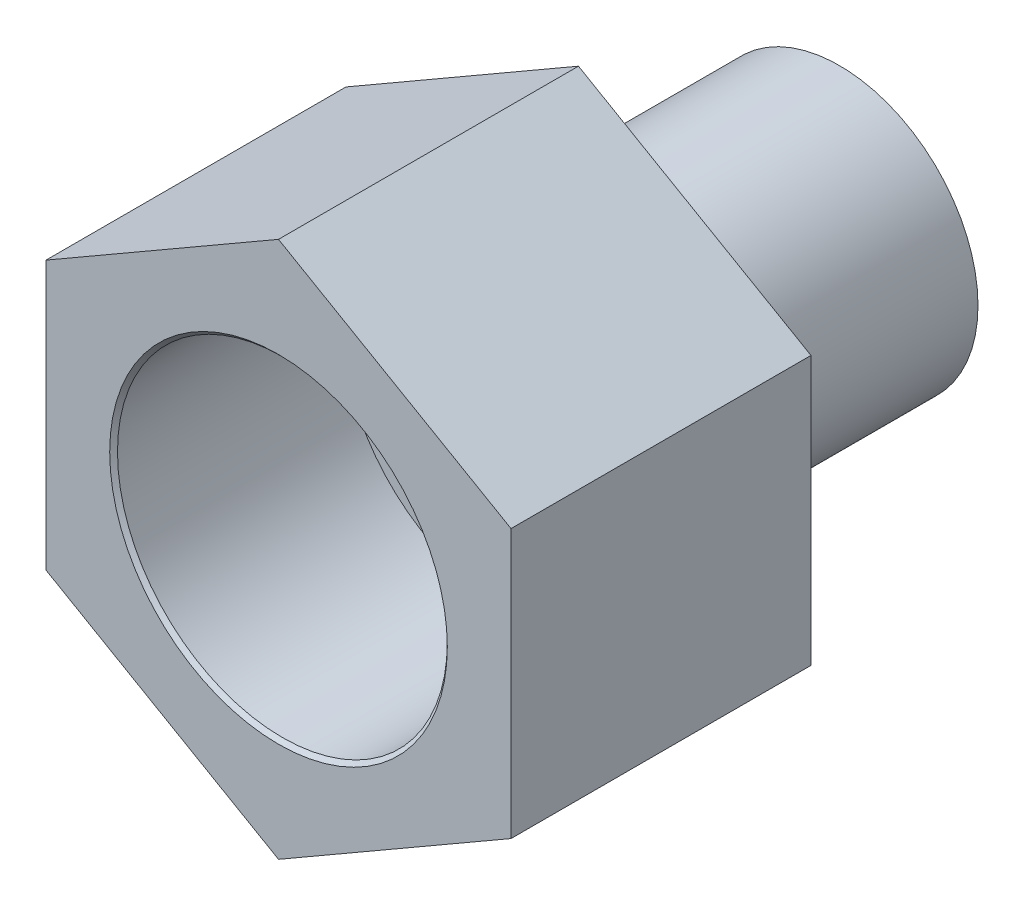
from build123d import *

# Parameters (mm, degrees)
SCHIZZO10_R                  = 20.675
ESTRUSIONE_ESTRUSIONE5_DEPTH = 43.2
TAGLIO_ESTRUSIONE11_DEPTH    = 23.1
FORO_25_5_25_4_1_D           = 25.4
FORO_25_5_25_4_1_DEPTH       = 17.6
FORO_25_5_25_4_1_CSINK_D     = 26
FORO_25_5_25_4_1_CSINK_ANGLE = 90
FORO_25_5_12_7_1_D           = 12.7
TAGLIO_ESTRUSIONE12_START    = -20.1
SCHIZZO24_R                  = 20.675
SCHIZZO24_R_2                = 10.668
TAGLIO_ESTRUSIONE12_DEPTH    = 20.1


with BuildPart() as part:
    # Schizzo10 → Estrusione-Estrusione5 (new body)
    with BuildSketch(Plane.XY):
        Circle(SCHIZZO10_R)
    extrude(amount=-ESTRUSIONE_ESTRUSIONE5_DEPTH)

    # Schizzo16 → Taglio-Estrusione11 (cut)
    with BuildSketch(Plane.XY):
        with BuildLine():
            ThreePointArc((17.905075223, 10.3375), (10.3375, 17.905075223), (0, 20.675))
            Line((0, 20.675), (17.905075223, 10.3375))
        make_face()
        with BuildLine():
            Line((-17.905075223, 10.3375), (0, 20.675))
            ThreePointArc((0, 20.675), (-10.3375, 17.905075223), (-17.905075223, 10.3375))
        make_face()
        with BuildLine():
            Line((-17.905075223, -10.3375), (-17.905075223, 10.3375))
            ThreePointArc((-17.905075223, 10.3375), (-20.675, 0), (-17.905075223, -10.3375))
        make_face()
        with BuildLine():
            ThreePointArc((17.905075223, -10.3375), (20.675, 0), (17.905075223, 10.3375))
            Line((17.905075223, 10.3375), (17.905075223, -10.3375))
        make_face()
        with BuildLine():
            Line((0, -20.675), (-17.905075223, -10.3375))
            ThreePointArc((-17.905075223, -10.3375), (-10.3375, -17.905075223), (0, -20.675))
        make_face()
        with BuildLine():
            ThreePointArc((0, -20.675), (10.3375, -17.905075223), (17.905075223, -10.3375))
            Line((17.905075223, -10.3375), (0, -20.675))
        make_face()
    extrude(amount=-TAGLIO_ESTRUSIONE11_DEPTH, mode=Mode.SUBTRACT)

    # Foro Ø25.5 (25.4)-1
    with Locations(Plane.XY):
        with Locations((0, 0)):
            CounterSinkHole(FORO_25_5_25_4_1_D / 2, FORO_25_5_25_4_1_CSINK_D / 2, depth=FORO_25_5_25_4_1_DEPTH, counter_sink_angle=FORO_25_5_25_4_1_CSINK_ANGLE)

    # Foro Ø25.5 (12.7)-1 (through all)
    with Locations(Plane.XY.offset(-17.6)):
        with Locations((0, 0)):
            Hole(FORO_25_5_12_7_1_D / 2)

    # Schizzo24 → Taglio-Estrusione12 (cut)
    with BuildSketch(Plane(origin=(0, 0, -43.2), x_dir=(-1, 0, 0), z_dir=(0, 0, -1)).offset(TAGLIO_ESTRUSIONE12_START)):
        Circle(SCHIZZO24_R)
        Circle(SCHIZZO24_R_2, mode=Mode.SUBTRACT)
    extrude(amount=TAGLIO_ESTRUSIONE12_DEPTH, mode=Mode.SUBTRACT)


solid = part.part
